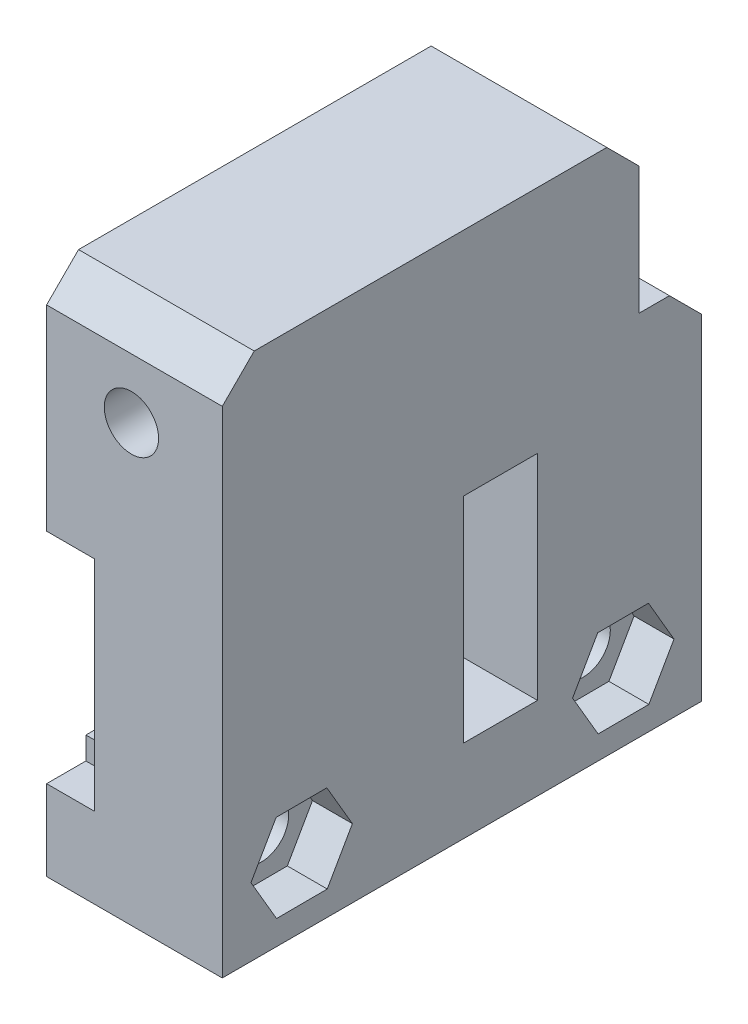
from build123d import *
from OCP.BRepAlgoAPI import BRepAlgoAPI_Cut
from OCP.TopTools import TopTools_ListOfShape

# Parameters (mm, degrees)
SKETCH1_W           = 30
SKETCH1_H           = 23
BOSS_EXTRUDE1_DEPTH = 11
SKETCH2_W           = 11
SKETCH2_H           = 26.078096673
BOSS_EXTRUDE2_DEPTH = 10
CHAMFER1_SIZE       = 2
SKETCH3_W           = 31.444464136
SKETCH3_H           = 13.690550156
CUT_EXTRUDE2_DEPTH  = 3
SKETCH4_W           = 15
SKETCH4_H           = 5
BOSS_EXTRUDE3_DEPTH = 5
SKETCH5_R           = 2.040999549
CUT_EXTRUDE3_DEPTH  = 15
SKETCH6_W           = 4.621469737
SKETCH6_H           = 13.3986797
CUT_EXTRUDE4_DEPTH  = 13
SKETCH7_R           = 1.7
CUT_EXTRUDE5_DEPTH  = 27
CUT_EXTRUDE6_DEPTH  = 2.5
CUT_EXTRUDE7_DEPTH  = 2.5
SKETCH11_W          = 5.001437903
SKETCH11_H          = 4.360411252
BOSS_EXTRUDE5_DEPTH = 8.5
SKETCH12_W          = 5.001437903
SKETCH12_H          = 4.360411252
BOSS_EXTRUDE6_DEPTH = 8.5
SKETCH10_R          = 1.7
CUT_EXTRUDE9_DEPTH  = 8.5


with BuildPart() as part:
    # Sketch1 → Boss-Extrude1 (new body)
    with BuildSketch(Plane(origin=(0, 0, 0), x_dir=(0, 0, -1), z_dir=(1, 0, 0))):
        Rectangle(SKETCH1_W, SKETCH1_H)
    extrude(amount=BOSS_EXTRUDE1_DEPTH)

    # Sketch2 → Boss-Extrude2 (add)
    with BuildSketch(Plane(origin=(0, 11.5, 0), x_dir=(1, 0, 0), z_dir=(0, 1, 0))):
        with Locations((5.5, -1.960954822)):
            Rectangle(SKETCH2_W, SKETCH2_H)
    extrude(amount=BOSS_EXTRUDE2_DEPTH)

    # Chamfer1
    chamfer1_edges = [part.edges().sort_by_distance(p)[0] for p in [
        (5.5, 11.5, -15),
        (5.5, 21.5, -11.078093514),
        (5.5, 21.5, 15.000003159),
    ]]
    chamfer(chamfer1_edges, length=CHAMFER1_SIZE)

    # Sketch3 → Cut-Extrude2 (cut)
    with BuildSketch(Plane.ZY):
        with Locations((0.26445091, 0.38357275)):
            Rectangle(SKETCH3_W, SKETCH3_H)
    extrude(amount=-CUT_EXTRUDE2_DEPTH, mode=Mode.SUBTRACT)

    # Sketch4 → Boss-Extrude3 (add)
    with BuildSketch(Plane(origin=(3, 0.435062227, 0), x_dir=(0, 0, 1), z_dir=(-1, 0, 0))):
        with Locations((-2.236096829, 0)):
            Rectangle(SKETCH4_W, SKETCH4_H)
    extrude(amount=BOSS_EXTRUDE3_DEPTH)

    # Sketch5 → Cut-Extrude3 (cut)
    with BuildSketch(Plane.XY.offset(5.263903171)):
        with Locations((0.634248811, 0.454719166)):
            Circle(SKETCH5_R)
    extrude(amount=-CUT_EXTRUDE3_DEPTH, mode=Mode.SUBTRACT)

    # Sketch6 → Cut-Extrude4 (cut)
    with BuildSketch(Plane(origin=(11, 0, 0), x_dir=(0, 0, -1), z_dir=(1, 0, 0))):
        with Locations((2.429578273, 0.383063563)):
            Rectangle(SKETCH6_W, SKETCH6_H)
    extrude(amount=-CUT_EXTRUDE4_DEPTH, mode=Mode.SUBTRACT)


with BuildPart() as cut_extrude5_tool:
    # Sketch7 → Cut-Extrude5 (new body)
    with BuildSketch(Plane.XY.offset(15)):
        with Locations((5.312142967, 15.762432364)):
            Circle(SKETCH7_R)
    extrude(amount=-CUT_EXTRUDE5_DEPTH)


with BuildPart() as part_1:
    add(part.part)

    # Cut-Extrude5: cut by cut_extrude5_tool, with a tolerance
    cut_extrude5_stock = TopTools_ListOfShape()
    cut_extrude5_stock.Append(part_1.part.wrapped)
    cut_extrude5_tools = TopTools_ListOfShape()
    cut_extrude5_tools.Append(cut_extrude5_tool.part.wrapped)
    cut_extrude5_cut = BRepAlgoAPI_Cut()
    cut_extrude5_cut.SetArguments(cut_extrude5_stock)
    cut_extrude5_cut.SetTools(cut_extrude5_tools)
    cut_extrude5_cut.SetFuzzyValue(0.00001)
    cut_extrude5_cut.Build()
    add(Compound.cast(cut_extrude5_cut.Shape()).solids(), mode=Mode.REPLACE)

    # Sketch8 → Cut-Extrude6 (cut)
    with BuildSketch(Plane(origin=(11, 0, 0), x_dir=(0, 0, -1), z_dir=(1, 0, 0))):
        Polygon((-8.427376058, -9.960684007), (-6.851986779, -7.203605489), (-8.451992176, -4.460739094), (-11.627386853, -4.474951216), (-13.202776131, -7.232029734), (-11.602770734, -9.974896129), align=None)
    extrude(amount=-CUT_EXTRUDE6_DEPTH, mode=Mode.SUBTRACT)

    # Sketch9 → Cut-Extrude7 (cut)
    with BuildSketch(Plane(origin=(11, 0, 0), x_dir=(0, 0, -1), z_dir=(1, 0, 0))):
        Polygon((11.709682534, -10.019030584), (13.285071813, -7.261952066), (11.685066416, -4.519085671), (8.50967174, -4.533297793), (6.934282461, -7.290376311), (8.534287858, -10.033242706), align=None)
    extrude(amount=-CUT_EXTRUDE7_DEPTH, mode=Mode.SUBTRACT)

    # Sketch11 → Boss-Extrude5 (add)
    with BuildSketch(Plane(origin=(8.5, 0, 0), x_dir=(0, 0, -1), z_dir=(1, 0, 0))):
        with Locations((10.097369078, -7.290376311)):
            Rectangle(SKETCH11_W, SKETCH11_H)
    extrude(amount=-BOSS_EXTRUDE5_DEPTH)

    # Sketch12 → Boss-Extrude6 (add)
    with BuildSketch(Plane(origin=(8.5, 0, 0), x_dir=(0, 0, -1), z_dir=(1, 0, 0))):
        with Locations((-10.039689515, -7.232029734)):
            Rectangle(SKETCH12_W, SKETCH12_H)
    extrude(amount=-BOSS_EXTRUDE6_DEPTH)

    # Sketch10 → Cut-Extrude9 (cut)
    with BuildSketch(Plane(origin=(8.5, 0, 0), x_dir=(0, 0, -1), z_dir=(1, 0, 0))):
        with Locations((10.097369078, -7.290376311)):
            Circle(SKETCH10_R)
        with Locations((-10.039689515, -7.232029734)):
            Circle(SKETCH10_R)
    extrude(amount=-CUT_EXTRUDE9_DEPTH, mode=Mode.SUBTRACT)


solid = part_1.part
